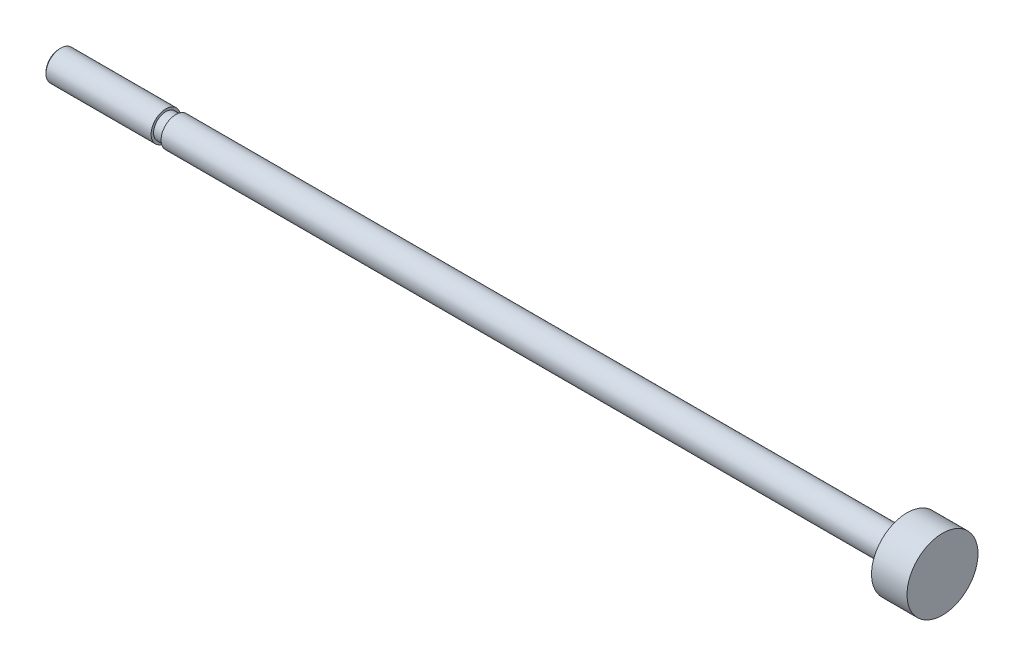
from build123d import *

# Parameters (mm, degrees)
SKETCH1_R           = 4.99999
SKETCH1_R_2         = 2.182749
SKETCH1_R_3         = 2.0828
SKETCH1_R_4         = 1.932813
SKETCH1_R_5         = 1.732788
BOSS_EXTRUDE2_DEPTH = 4.99999
SKETCH1_5_R         = 2.0828
BOSS_EXTRUDE3_DEPTH = 107.999884076
BOSS_EXTRUDE4_START = -107.999884
SKETCH1_6_R         = 1.932813
BOSS_EXTRUDE4_DEPTH = 0.199898
BOSS_EXTRUDE5_START = -108.199782
SKETCH1_7_R         = 1.732788
BOSS_EXTRUDE5_DEPTH = 1.199896
BOSS_EXTRUDE6_START = -109.399678
SKETCH1_8_R         = 2.0828
BOSS_EXTRUDE6_DEPTH = 14.99997
CHAMFER1_SIZE       = 0.2032
CHAMFER2_SIZE       = 0.1905


with BuildPart() as part:
    # Sketch1 → Boss-Extrude2 (new body)
    # profile 1 of 5: a face of its own
    with BuildSketch(Plane(origin=(0, 0, 0), x_dir=(0, 0, -1), z_dir=(1, 0, 0))):
        Circle(SKETCH1_R)
        Circle(SKETCH1_R_2, mode=Mode.SUBTRACT)
    # profile 2 of 5: a face of its own
    with BuildSketch(Plane(origin=(0, 0, 0), x_dir=(0, 0, -1), z_dir=(1, 0, 0))):
        Circle(SKETCH1_R_2)
        Circle(SKETCH1_R_3, mode=Mode.SUBTRACT)
    # profile 3 of 5: a face of its own
    with BuildSketch(Plane(origin=(0, 0, 0), x_dir=(0, 0, -1), z_dir=(1, 0, 0))):
        Circle(SKETCH1_R_3)
        Circle(SKETCH1_R_4, mode=Mode.SUBTRACT)
    # profile 4 of 5: a face of its own
    with BuildSketch(Plane(origin=(0, 0, 0), x_dir=(0, 0, -1), z_dir=(1, 0, 0))):
        Circle(SKETCH1_R_4)
        Circle(SKETCH1_R_5, mode=Mode.SUBTRACT)
    # profile 5 of 5: a face of its own
    with BuildSketch(Plane(origin=(0, 0, 0), x_dir=(0, 0, -1), z_dir=(1, 0, 0))):
        Circle(SKETCH1_R_5)
    extrude(amount=-BOSS_EXTRUDE2_DEPTH)

    # Sketch1<5> → Boss-Extrude3 (add)
    with BuildSketch(Plane(origin=(0, 0, 0), x_dir=(0, 0, -1), z_dir=(1, 0, 0))):
        Circle(SKETCH1_5_R)
    extrude(amount=-BOSS_EXTRUDE3_DEPTH)

    # Sketch1<6> → Boss-Extrude4 (add)
    with BuildSketch(Plane(origin=(0, 0, 0), x_dir=(0, 0, -1), z_dir=(1, 0, 0)).offset(BOSS_EXTRUDE4_START)):
        Circle(SKETCH1_6_R)
    extrude(amount=-BOSS_EXTRUDE4_DEPTH)

    # Sketch1<7> → Boss-Extrude5 (add)
    with BuildSketch(Plane(origin=(0, 0, 0), x_dir=(0, 0, -1), z_dir=(1, 0, 0)).offset(BOSS_EXTRUDE5_START)):
        Circle(SKETCH1_7_R)
    extrude(amount=-BOSS_EXTRUDE5_DEPTH)

    # Sketch1<8> → Boss-Extrude6 (add)
    with BuildSketch(Plane(origin=(0, 0, 0), x_dir=(0, 0, -1), z_dir=(1, 0, 0)).offset(BOSS_EXTRUDE6_START)):
        Circle(SKETCH1_8_R)
    extrude(amount=-BOSS_EXTRUDE6_DEPTH)

    # Chamfer1
    # the kernel refuses this chamfer: 0.2032 mm, written as the material it takes off along each edge
    with BuildSketch(Plane(origin=(-108.199782, 0, 0), x_dir=(0, 0, -1), z_dir=(0, -1, 0))) as chamfer1_piece_1_section:
        Polygon((1.932813 - CHAMFER1_SIZE, 0), (1.932813, CHAMFER1_SIZE), (1.932813, 0), align=None)
    chamfer1_piece_1 = revolve(axis=Axis((-108.199782, 0, 0), (1, 0, 0)), mode=Mode.PRIVATE)
    chamfer1_piece_1 = chamfer1_piece_1 - Plane(origin=(-108.102785336, 0, 0), x_dir=(0, 0, -1), z_dir=(1, 0, 0)) * Cylinder(1.732788, 8, mode=Mode.PRIVATE)
    chamfer1_piece_1 = split(chamfer1_piece_1, bisect_by=Plane(origin=(-107.999884076, 0, 1.83568926), z_dir=(-1, 0, 0)), keep=Keep.TOP, mode=Mode.PRIVATE)
    add(chamfer1_piece_1, mode=Mode.SUBTRACT)

    # Chamfer2
    chamfer2_edges = [part.edges().sort_by_distance(p)[0] for p in [
        (-124.399648, 0, 2.0828),
    ]]
    chamfer(chamfer2_edges, length=CHAMFER2_SIZE)


solid = part.part
